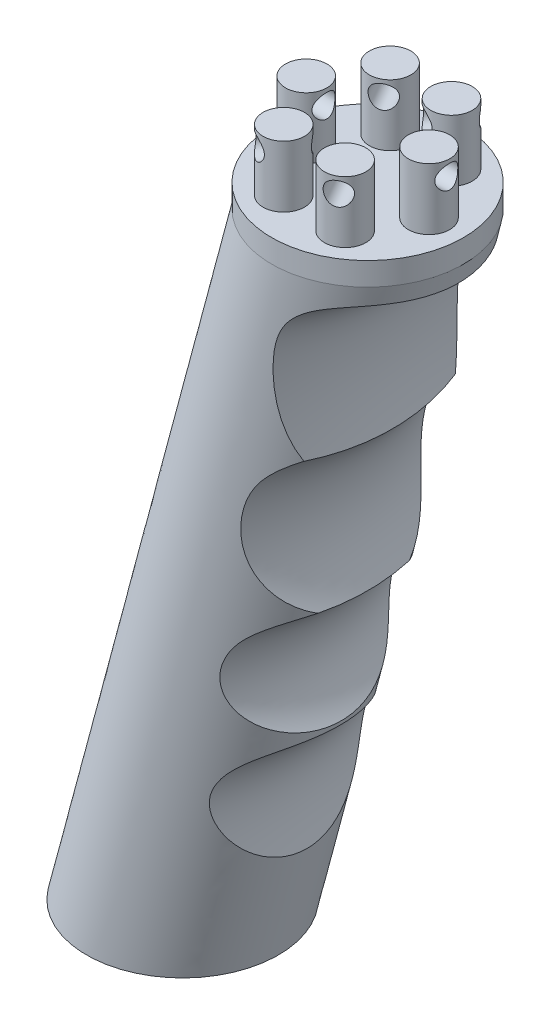
from build123d import *

# Parameters (mm, degrees)
SKETCH_2_R                    = 2.7
EXTRUDE_1_DEPTH               = 8
EXTRUDE_1_2_DEPTH             = 8
EXTRUDE_1_3_DEPTH             = 8
EXTRUDE_1_4_DEPTH             = 8
EXTRUDE_1_5_DEPTH             = 8
EXTRUDE_1_6_DEPTH             = 8
SKETCH_3_R                    = 12.5
EXTRUDE_2_DEPTH               = 3
CUT_REVOLVE_2_ANGLE           = 30
CUT_REVOLVE_2_OTHER_WAY_ANGLE = 30
CUT_REVOLVE_3_ANGLE           = 30
CUT_REVOLVE_3_OTHER_WAY_ANGLE = 30
CUT_EXTRUDE_1_DEPTH           = 109.157013401
CUT_EXTRUDE_1_DEPTH_BACK      = 109.157013401
SKETCH_5_R                    = 1.5
CUT_EXTRUDE_4_DEPTH           = 108.954066061
CUT_EXTRUDE_4_DEPTH_BACK      = 108.954066061
SKETCH_7_R                    = 1.5
CUT_EXTRUDE_5_DEPTH           = 108.954066061
CUT_EXTRUDE_5_DEPTH_BACK      = 108.954066061
SKETCH_6_R                    = 1.5


with BuildPart() as part:
    # 草图2 → 凸台-拉伸1 (new body)
    with BuildSketch(Plane(origin=(0, 0, 0), x_dir=(1, 0, 0), z_dir=(0, 1, 0))):
        with Locations(Location((-4, 6.92820323, 0), (0, 0, 270))):
            Circle(SKETCH_2_R)
    extrude(amount=-EXTRUDE_1_DEPTH)



with BuildPart() as body_2:
    # 草图2 → Extrude 1 2 (new body)
    with BuildSketch(Plane(origin=(0, 0, 0), x_dir=(1, 0, 0), z_dir=(0, 1, 0))):
        with Locations(Location((4, 6.92820323, 0), (0, 0, 270))):
            Circle(SKETCH_2_R)
    extrude(amount=-EXTRUDE_1_2_DEPTH)


with BuildPart() as body_3:
    # 草图2 → Extrude 1 3 (new body)
    with BuildSketch(Plane(origin=(0, 0, 0), x_dir=(1, 0, 0), z_dir=(0, 1, 0))):
        with Locations(Location((8, 0, 0), (0, 0, 270))):
            Circle(SKETCH_2_R)
    extrude(amount=-EXTRUDE_1_3_DEPTH)


with BuildPart() as body_4:
    # 草图2 → Extrude 1 4 (new body)
    with BuildSketch(Plane(origin=(0, 0, 0), x_dir=(1, 0, 0), z_dir=(0, 1, 0))):
        with Locations(Location((4, -6.92820323, 0), (0, 0, 270))):
            Circle(SKETCH_2_R)
    extrude(amount=-EXTRUDE_1_4_DEPTH)


with BuildPart() as body_5:
    # 草图2 → Extrude 1 5 (new body)
    with BuildSketch(Plane(origin=(0, 0, 0), x_dir=(1, 0, 0), z_dir=(0, 1, 0))):
        with Locations(Location((-4, -6.92820323, 0), (0, 0, 270))):
            Circle(SKETCH_2_R)
    extrude(amount=-EXTRUDE_1_5_DEPTH)


with BuildPart() as body_6:
    # 草图2 → Extrude 1 6 (new body)
    with BuildSketch(Plane(origin=(0, 0, 0), x_dir=(1, 0, 0), z_dir=(0, 1, 0))):
        with Locations(Location((-8, 0, 0), (0, 0, 270))):
            Circle(SKETCH_2_R)
    extrude(amount=-EXTRUDE_1_6_DEPTH)


with BuildPart() as part_1:
    add(part.part)

    add(body_2.part)  # 凸台-拉伸2 merges body 2

    add(body_3.part)  # 凸台-拉伸2 merges body 3

    add(body_4.part)  # 凸台-拉伸2 merges body 4

    add(body_5.part)  # 凸台-拉伸2 merges body 5

    add(body_6.part)  # 凸台-拉伸2 merges body 6
    # 草图3 → 凸台-拉伸2 (add)
    with BuildSketch(Plane.XZ.offset(8)):
        with Locations(Location((0, 0, 0), (0, 0, 270))):
            Circle(SKETCH_3_R)
    extrude(amount=EXTRUDE_2_DEPTH)

    # 扫描2: read off the stored shape, not the designer's step
    # 扫描2: loft between two sections, ruled curve by curve
    sweep_2_from = [
        Edge.make_bspline([(0, -11, -12.5), (25, -11, -12.5), (25, -11, 12.5), (0, -11, 12.5), (-25, -11, 12.5), (-25, -11, -12.5), (0, -11, -12.5)], [0, 0, 0, 0, 0.5, 0.5, 0.5, 1, 1, 1, 1], 3, [1, 0.333333333, 0.333333333, 1, 0.333333333, 0.333333333, 1]),
    ]
    sweep_2_to = [
        Edge.make_bspline([(-24.115427319, -101, -12.5), (0.884572681, -101, -12.5), (0.884572681, -101, 12.5), (-24.115427319, -101, 12.5), (-49.115427319, -101, 12.5), (-49.115427319, -101, -12.5), (-24.115427319, -101, -12.5)], [0, 0, 0, 0, 0.5, 0.5, 0.5, 1, 1, 1, 1], 3, [1, 0.333333333, 0.333333333, 1, 0.333333333, 0.333333333, 1]),
    ]
    sweep_2 = Solid(Shell([*[Face.make_surface_from_curves(sweep_2_from[k], sweep_2_to[k]) for k in range(1)], Face(Wire(sweep_2_from)), Face(Wire(sweep_2_to))]))
    add(sweep_2)

    # 草图4<8> → 切除-旋转2 (revolve, cut)
    with BuildSketch(Plane.XY):
        with BuildLine():
            Line((16.229404145, -16.400190776), (28.80431756, -66.412396329))
            add(Edge.make_bspline(
                [(16.229404145, -16.400190776), (14.792307655, -11.5110905), (4.572132893, -13.275760919), (-0.757049157, -41.22006159), (16.640020093, -64.15006919), (28.80431756, -66.412396329)],
                knots=[0, 0, 0, 0, 0.252126002, 0.311986574, 1, 1, 1, 1], degree=3))
        make_face()
        with BuildLine():
            Line((11.741718831, -33.148460374), (14.050084465, -72.533659014))
            add(Edge.make_bspline(
                [(11.741718831, -33.148460374), (12.183645177, -27.542827835), (1.430815858, -33.593950928), (-4.491463395, -49.126107671), (9.965481676, -67.291558955), (7.144356213, -59.250059535), (14.050084465, -72.533659014)],
                knots=[0, 0, 0, 0, 0.169700121, 0.221223295, 0.482564136, 1, 1, 1, 1], degree=3))
        make_face()
        with BuildLine():
            Line((7.21340678, -50.048351022), (8.314641817, -89.493323218))
            add(Edge.make_bspline(
                [(7.21340678, -50.048351022), (7.234189384, -49.987560848), (-2.213842853, -53.692124096), (-7.91518016, -66.344703791), (-2.56173781, -71.828247434), (4.612590907, -77.264324621), (4.152997429, -84.080098597), (8.314641817, -89.493323218)],
                knots=[0, 0, 0, 0, 0.254350652, 0.317599911, 0.597504518, 0.669243334, 1, 1, 1, 1], degree=3))
        make_face()
    revolve(axis=Axis((-47.788075752, -112.073460601, 0), (0.2588190451025246, 0.9659258262890673, 0)), revolution_arc=CUT_REVOLVE_2_ANGLE, mode=Mode.SUBTRACT)

    # 草图4<8> → 切除-旋转2 other way (revolve, cut)
    with BuildSketch(Plane.XY):
        with BuildLine():
            Line((16.229404145, -16.400190776), (28.80431756, -66.412396329))
            add(Edge.make_bspline(
                [(16.229404145, -16.400190776), (14.792307655, -11.5110905), (4.572132893, -13.275760919), (-0.757049157, -41.22006159), (16.640020093, -64.15006919), (28.80431756, -66.412396329)],
                knots=[0, 0, 0, 0, 0.252126002, 0.311986574, 1, 1, 1, 1], degree=3))
        make_face()
        with BuildLine():
            Line((11.741718831, -33.148460374), (14.050084465, -72.533659014))
            add(Edge.make_bspline(
                [(11.741718831, -33.148460374), (12.183645177, -27.542827835), (1.430815858, -33.593950928), (-4.491463395, -49.126107671), (9.965481676, -67.291558955), (7.144356213, -59.250059535), (14.050084465, -72.533659014)],
                knots=[0, 0, 0, 0, 0.169700121, 0.221223295, 0.482564136, 1, 1, 1, 1], degree=3))
        make_face()
        with BuildLine():
            Line((7.21340678, -50.048351022), (8.314641817, -89.493323218))
            add(Edge.make_bspline(
                [(7.21340678, -50.048351022), (7.234189384, -49.987560848), (-2.213842853, -53.692124096), (-7.91518016, -66.344703791), (-2.56173781, -71.828247434), (4.612590907, -77.264324621), (4.152997429, -84.080098597), (8.314641817, -89.493323218)],
                knots=[0, 0, 0, 0, 0.254350652, 0.317599911, 0.597504518, 0.669243334, 1, 1, 1, 1], degree=3))
        make_face()
    revolve(axis=Axis((-47.788075752, -112.073460601, 0), (-0.2588190451025246, -0.9659258262890673, 0)), revolution_arc=CUT_REVOLVE_2_OTHER_WAY_ANGLE, mode=Mode.SUBTRACT)

    # 草图4<10> → 切除-旋转3 (revolve, cut)
    with BuildSketch(Plane.XY):
        with BuildLine():
            Line((2.206200287, -68.735500058), (-1.202990426, -113.931124021))
            add(Edge.make_bspline(
                [(2.206200287, -68.735500058), (-2.043142897, -69.19418534), (-12.297265031, -76.02528662), (-7.025942855, -89.755898505), (-2.819449969, -102.215440123), (-4.915793051, -109.665489189), (-1.202990426, -113.931124021)],
                knots=[0, 0, 0, 0, 0.348734393, 0.625938818, 0.694530434, 1, 1, 1, 1], degree=3))
        make_face()
    revolve(axis=Axis((-47.788075752, -112.073460601, 0), (0.2588190451025246, 0.9659258262890673, 0)), revolution_arc=CUT_REVOLVE_3_ANGLE, mode=Mode.SUBTRACT)

    # 草图4<10> → 切除-旋转3 other way (revolve, cut)
    with BuildSketch(Plane.XY):
        with BuildLine():
            Line((2.206200287, -68.735500058), (-1.202990426, -113.931124021))
            add(Edge.make_bspline(
                [(2.206200287, -68.735500058), (-2.043142897, -69.19418534), (-12.297265031, -76.02528662), (-7.025942855, -89.755898505), (-2.819449969, -102.215440123), (-4.915793051, -109.665489189), (-1.202990426, -113.931124021)],
                knots=[0, 0, 0, 0, 0.348734393, 0.625938818, 0.694530434, 1, 1, 1, 1], degree=3))
        make_face()
    revolve(axis=Axis((-47.788075752, -112.073460601, 0), (-0.2588190451025246, -0.9659258262890673, 0)), revolution_arc=CUT_REVOLVE_3_OTHER_WAY_ANGLE, mode=Mode.SUBTRACT)

    # 草图5 → 切除-拉伸1 (cut, two sides: drawn at the far end of the back side and taken through both)
    with BuildSketch(Plane(origin=(0, 0, 0), x_dir=(0, 0, -1), z_dir=(1, 0, 0)).offset(-CUT_EXTRUDE_1_DEPTH_BACK)):
        with Locations((0, -2)):
            Circle(SKETCH_5_R)
    extrude(amount=CUT_EXTRUDE_1_DEPTH + CUT_EXTRUDE_1_DEPTH_BACK, mode=Mode.SUBTRACT)

    # 草图7 → 切除-拉伸4 (cut, two sides: drawn at the far end of the back side and taken through both)
    with BuildSketch(Plane(origin=(-2, 0, -3.464101615), x_dir=(0.8660254037844137, 0, -0.5000000000000434), z_dir=(0.5000000000000434, 0, 0.8660254037844137)).offset(-CUT_EXTRUDE_4_DEPTH_BACK)):
        with Locations((0, -2)):
            Circle(SKETCH_7_R)
    extrude(amount=CUT_EXTRUDE_4_DEPTH + CUT_EXTRUDE_4_DEPTH_BACK, mode=Mode.SUBTRACT)

    # 草图6 → 切除-拉伸5 (cut, two sides: drawn at the far end of the back side and taken through both)
    with BuildSketch(Plane(origin=(-2, 0, 3.464101615), x_dir=(-0.8660254037844635, 0, -0.49999999999995715), z_dir=(0.4999999999999571, 0, -0.8660254037844634)).offset(-CUT_EXTRUDE_5_DEPTH_BACK)):
        with Locations((0, -2)):
            Circle(SKETCH_6_R)
    extrude(amount=CUT_EXTRUDE_5_DEPTH + CUT_EXTRUDE_5_DEPTH_BACK, mode=Mode.SUBTRACT)


solid = part_1.part
